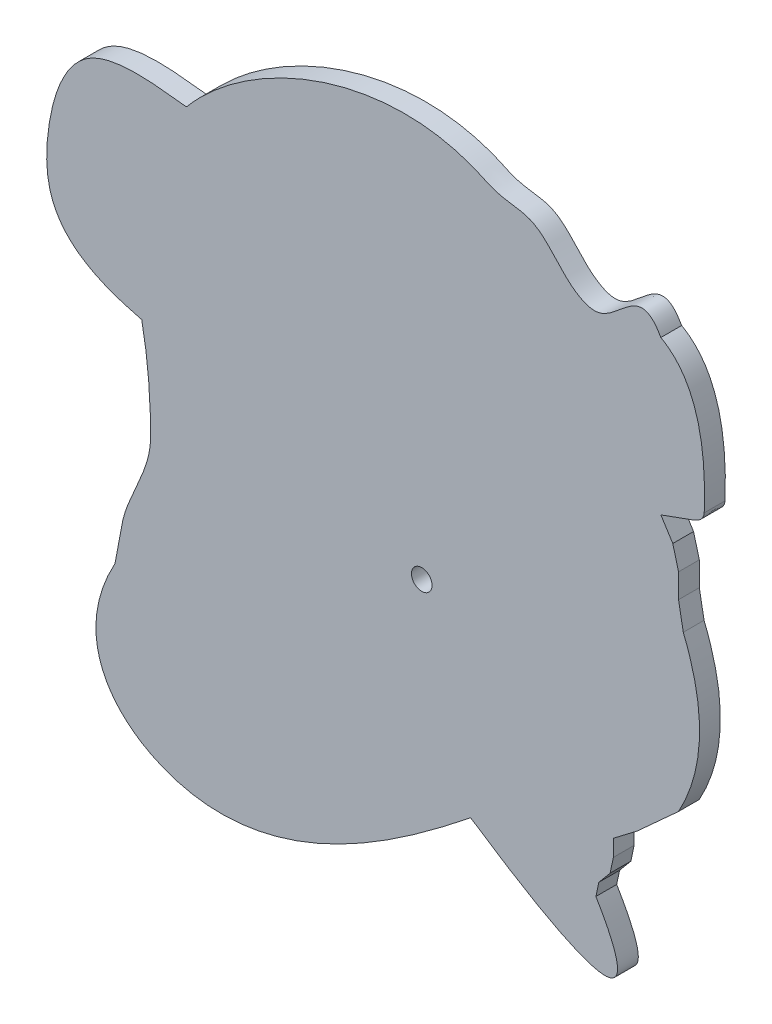
from build123d import *

# Parameters (mm, degrees)
SKETCH1_R           = 1.5748
BOSS_EXTRUDE2_DEPTH = 3.175


with BuildPart() as part:
    # Sketch1 → Boss-Extrude2 (new body)
    with BuildSketch(Plane.XY):
        with BuildLine():
            Line((158.848647409, 158.065989154), (159.287258197, 160.158039444))
            Line((159.287258197, 160.158039444), (161.024283069, 162.24246929))
            Line((161.024283069, 162.24246929), (161.51276424, 164.572387305))
            Line((161.51276424, 164.572387305), (161.51276424, 167.102297744))
            Line((161.51276424, 167.102297744), (165.183542032, 169.901250177))
            Line((165.183542032, 169.901250177), (171.472031107, 175.621746691))
            add(Edge.make_bspline(
                [(172.196352762, 199.687728108), (177.512545782, 186.611864968), (171.472031107, 175.621746691)],
                knots=[0, 0, 0, 1, 1, 1], degree=2))
            Line((172.196352762, 199.687728108), (171.472031107, 203.640454502))
            Line((171.472031107, 203.640454502), (171.472031107, 207.328620776))
            Line((171.472031107, 207.328620776), (170.591456875, 210.633600942))
            Line((170.591456875, 210.633600942), (168.77132287, 213.50749674))
            Line((168.77132287, 213.50749674), (173.762076079, 215.323183876))
            add(Edge.make_bspline(
                [(173.762076079, 215.323183876), (175.299052296, 215.889997376), (175.39725561, 217.089480705)],
                knots=[0, 0, 0, 1, 1, 1], degree=2))
            add(Edge.make_bspline(
                [(168.77132287, 236.972843892), (176.024535693, 232.91356426), (175.39725561, 217.089480705)],
                knots=[0, 0, 0, 1, 1, 1], degree=2))
            add(Edge.make_bspline(
                [(168.77132287, 236.972843892), (165.348333102, 243.181818321), (161.713024872, 233.590500252), (153.591853048, 237.311005477), (150.562230052, 243.292497992), (144.26627276, 243.172724883), (127.539588232, 251.709519765), (106.089408502, 242.945117572), (96.305367629, 231.252858967)],
                knots=[0, 0, 0, 0, 0.145953372, 0.187032347, 0.301264876, 0.367851833, 0.402074687, 1, 1, 1, 1], degree=3))
            add(Edge.make_bspline(
                [(89.47301913, 199.687728108), (76.414076731, 202.778398102), (72.921006176, 212.695352185), (79.130886224, 233.86725835), (92.35711514, 231.654519072), (96.305367629, 231.252858967)],
                knots=[0, 0, 0, 0, 0.435393148, 0.719886863, 1, 1, 1, 1], degree=3))
            add(Edge.make_bspline(
                [(89.47301913, 199.687728108), (90.449698127, 194.83749072), (90.825955315, 189.837761557), (90.838257386, 180.280743918), (87.678298822, 176.191377166), (86.590775441, 171.767770411)],
                knots=[0, 0, 0, 0, 0.517811069, 0.520823107, 1, 1, 1, 1], degree=3))
            Line((86.590775441, 171.767770411), (85.388246292, 165.381063893))
            add(Edge.make_bspline(
                [(85.388246292, 165.381063893), (78.04872596, 152.035766171), (100.062572602, 129.842406555), (127.319187547, 149.003850163), (139.710762388, 158.909562117)],
                knots=[0, 0, 0, 0, 0.355983936, 1, 1, 1, 1], degree=3))
            add(Edge.make_bspline(
                [(139.710762388, 158.909562117), (170.754327721, 138.111319354), (158.848647409, 158.065989154)],
                knots=[0, 0, 0, 1, 1, 1], degree=2))
        make_face()
        with Locations((132.246698131, 186.701821083)):
            Circle(SKETCH1_R, mode=Mode.SUBTRACT)
    extrude(amount=BOSS_EXTRUDE2_DEPTH)


solid = part.part
